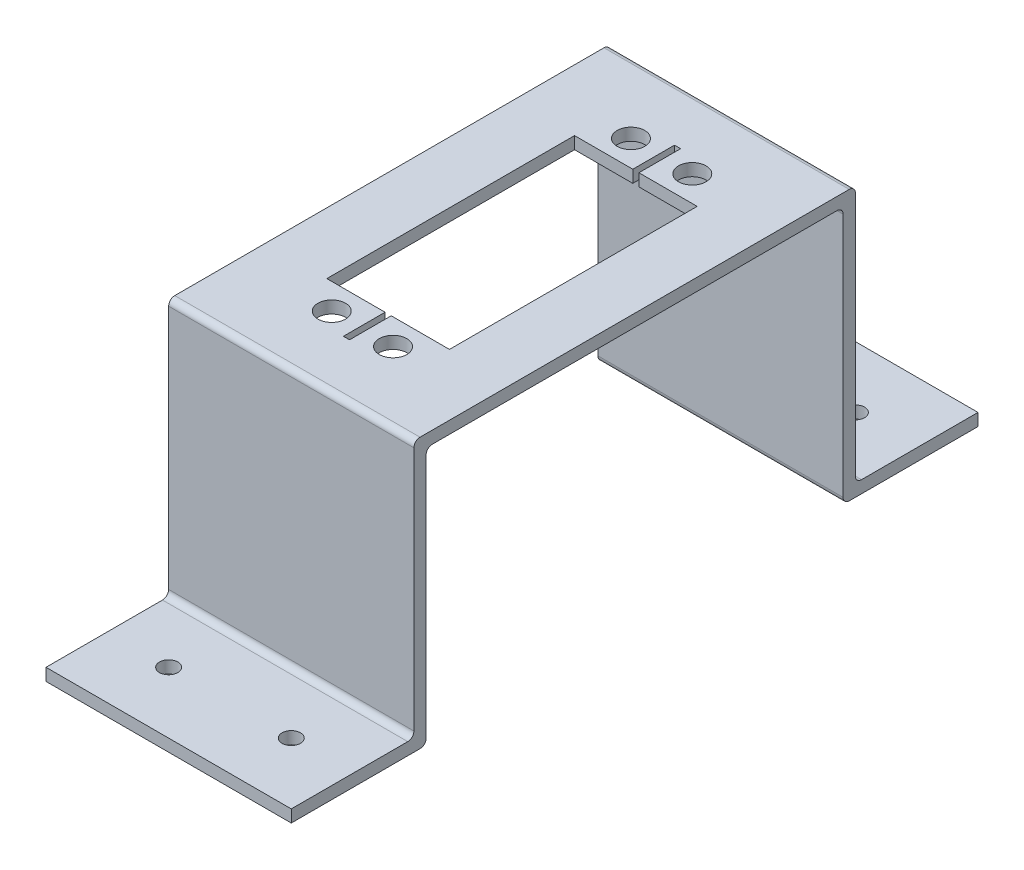
from build123d import *

# Parameters (mm, degrees)
SKETCH1_W           = 40
SKETCH1_H           = 100
SKETCH1_R           = 1.5
SKETCH1_R_2         = 2.25
BOSS_EXTRUDE1_DEPTH = 2
SKETCH2_W           = 40
SKETCH2_H           = 16
CUT_EXTRUDE1_DEPTH  = 10
SKETCH4_W           = 40
SKETCH4_H           = 2
BOSS_EXTRUDE2_DEPTH = 44
SKETCH5_W           = 40
SKETCH5_H           = 2
BOSS_EXTRUDE3_DEPTH = 20
SKETCH6_W           = 40
SKETCH6_H           = 2
BOSS_EXTRUDE4_DEPTH = 20
FILLET1_R           = 1
SKETCH7_R           = 1.5
CUT_EXTRUDE2_DEPTH  = 20
SKETCH8_R           = 1.5
CUT_EXTRUDE3_DEPTH  = 20


with BuildPart() as part:
    # Sketch1 → Boss-Extrude1 (new body)
    with BuildSketch(Plane(origin=(0, 0, 0), x_dir=(1, 0, 0), z_dir=(0, 1, 0))):
        with Locations((0.735982487, -0.367991244)):
            Rectangle(SKETCH1_W, SKETCH1_H)
        with Locations((-9.264017513, -40.367991244)):
            Circle(SKETCH1_R, mode=Mode.SUBTRACT)
        with Locations((-4.264017513, -24.767991244)):
            Circle(SKETCH1_R_2, mode=Mode.SUBTRACT)
        with Locations((10.735982487, -40.367991244)):
            Circle(SKETCH1_R, mode=Mode.SUBTRACT)
        with Locations((5.735982487, -24.767991244)):
            Circle(SKETCH1_R_2, mode=Mode.SUBTRACT)
        with Locations((-4.264017513, 24.032008756)):
            Circle(SKETCH1_R_2, mode=Mode.SUBTRACT)
        with Locations((-9.264017513, 39.632008756)):
            Circle(SKETCH1_R, mode=Mode.SUBTRACT)
        Polygon((0.235982487, 26.632008756), (0.735982487, 26.632008756), (1.235982487, 26.632008756), (1.235982487, 19.832008756), (10.735982487, 19.832008756), (10.735982487, -20.567991244), (1.235982487, -20.567991244), (1.235982487, -27.367991244), (0.735982487, -27.367991244), (0.235982487, -27.367991244), (0.235982487, -20.567991244), (-9.264017513, -20.567991244), (-9.264017513, 19.832008756), (0.235982487, 19.832008756), align=None, mode=Mode.SUBTRACT)
        with Locations((5.735982487, 24.032008756)):
            Circle(SKETCH1_R_2, mode=Mode.SUBTRACT)
        with Locations((10.735982487, 39.632008756)):
            Circle(SKETCH1_R, mode=Mode.SUBTRACT)
    extrude(amount=BOSS_EXTRUDE1_DEPTH)

    # Sketch2 → Cut-Extrude1 (cut)
    with BuildSketch(Plane(origin=(0, 2, 0), x_dir=(1, 0, 0), z_dir=(0, 1, 0))):
        with Locations((0.735982487, 41.632008756)):
            Rectangle(SKETCH2_W, SKETCH2_H)
        with Locations((0.735982487, -42.367991244)):
            Rectangle(SKETCH2_W, SKETCH2_H)
    extrude(amount=-CUT_EXTRUDE1_DEPTH, mode=Mode.SUBTRACT)

    # Sketch4 → Boss-Extrude2 (add)
    with BuildSketch(Plane(origin=(0, 2, 0), x_dir=(1, 0, 0), z_dir=(0, 1, 0))):
        with Locations((0.735982487, -35.367991244)):
            Rectangle(SKETCH4_W, SKETCH4_H)
        with Locations((0.735982487, 34.632008756)):
            Rectangle(SKETCH4_W, SKETCH4_H)
    extrude(amount=-BOSS_EXTRUDE2_DEPTH)

    # Sketch5 → Boss-Extrude3 (add)
    with BuildSketch(Plane(origin=(0, 0, -35.632008756), x_dir=(-1, 0, 0), z_dir=(0, 0, -1))):
        with Locations((-0.735982487, -41)):
            Rectangle(SKETCH5_W, SKETCH5_H)
    extrude(amount=BOSS_EXTRUDE3_DEPTH)

    # Sketch6 → Boss-Extrude4 (add)
    with BuildSketch(Plane.XY.offset(36.367991244)):
        with Locations((0.735982487, -41)):
            Rectangle(SKETCH6_W, SKETCH6_H)
    extrude(amount=BOSS_EXTRUDE4_DEPTH)

    # Fillet1
    fillet1_edges = [part.edges().sort_by_distance(p)[0] for p in [
        (0.735982487, -42, -33.632008756),
        (0.735982487, -40, -35.632008756),
        (0.735982487, 2, -35.632008756),
        (0.735982487, 0, -33.632008756),
        (0.735982487, 0, 34.367991244),
        (0.735982487, 2, 36.367991244),
        (0.735982487, -42, 34.367991244),
        (0.735982487, -40, 36.367991244),
    ]]
    fillet(fillet1_edges, radius=FILLET1_R)

    # Sketch7 → Cut-Extrude2 (cut)
    with BuildSketch(Plane(origin=(0, -40, 0), x_dir=(1, 0, 0), z_dir=(0, 1, 0))):
        with Locations((-9.264017513, 45.632008756)):
            Circle(SKETCH7_R)
        with Locations((10.735982487, 45.632008756)):
            Circle(SKETCH7_R)
    extrude(amount=-CUT_EXTRUDE2_DEPTH, mode=Mode.SUBTRACT)

    # Sketch8 → Cut-Extrude3 (cut)
    with BuildSketch(Plane(origin=(0, -40, 0), x_dir=(1, 0, 0), z_dir=(0, 1, 0))):
        with Locations((10.735982487, -46.367991244)):
            Circle(SKETCH8_R)
        with Locations((-9.264017513, -46.367991244)):
            Circle(SKETCH8_R)
    extrude(amount=-CUT_EXTRUDE3_DEPTH, mode=Mode.SUBTRACT)


solid = part.part
